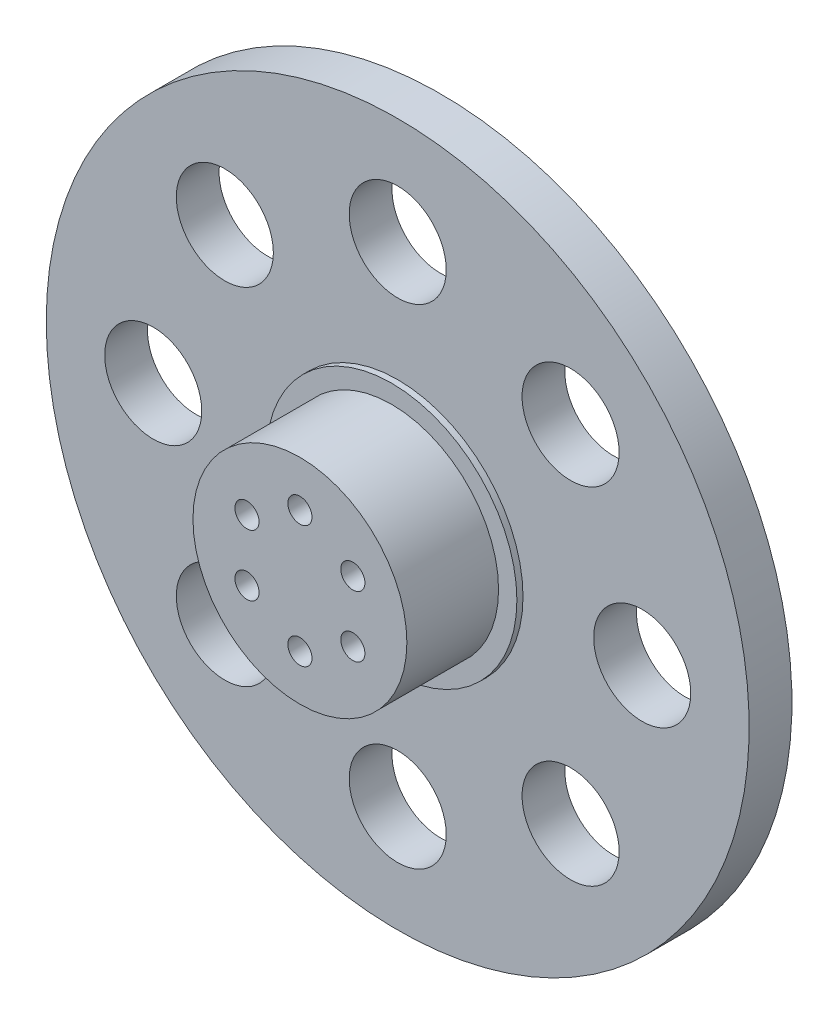
from build123d import *

# Parameters (mm, degrees)
SKETCH1_R           = 17.5
BOSS_EXTRUDE1_DEPTH = 15
SKETCH7_R           = 20.5
BOSS_EXTRUDE3_DEPTH = 1
SKETCH3_R           = 57.5
BOSS_EXTRUDE2_DEPTH = 7
SKETCH4_R           = 11
CUT_EXTRUDE1_DEPTH  = 7
SKETCH5_R           = 7.5
CUT_EXTRUDE2_DEPTH  = 0.5
SKETCH6_R           = 1.975
CUT_EXTRUDE3_DEPTH  = 6
CIRPATTERN1_COUNT   = 6
SKETCH8_R           = 7.94
CUT_EXTRUDE4_DEPTH  = 83.876414015


with BuildPart() as part:
    # Sketch1 → Boss-Extrude1 (new body)
    with BuildSketch(Plane.XY):
        Circle(SKETCH1_R)
    extrude(amount=BOSS_EXTRUDE1_DEPTH)

    # Sketch7 → Boss-Extrude3 (add)
    with BuildSketch(Plane(origin=(0, 0, 0), x_dir=(-1, 0, 0), z_dir=(0, 0, -1))):
        Circle(SKETCH7_R)
    extrude(amount=BOSS_EXTRUDE3_DEPTH)

    # Sketch3 → Boss-Extrude2 (add)
    with BuildSketch(Plane(origin=(0, 0, -1), x_dir=(-1, 0, 0), z_dir=(0, 0, -1))):
        Circle(SKETCH3_R)
    extrude(amount=BOSS_EXTRUDE2_DEPTH)

    # Sketch4 → Cut-Extrude1 (cut)
    with BuildSketch(Plane(origin=(0, 0, -8), x_dir=(-1, 0, 0), z_dir=(0, 0, -1))):
        Circle(SKETCH4_R)
    extrude(amount=-CUT_EXTRUDE1_DEPTH, mode=Mode.SUBTRACT)

    # Sketch5 → Cut-Extrude2 (cut)
    with BuildSketch(Plane(origin=(0, 0, -1), x_dir=(-1, 0, 0), z_dir=(0, 0, -1))):
        Circle(SKETCH5_R)
    extrude(amount=-CUT_EXTRUDE2_DEPTH, mode=Mode.SUBTRACT)

    # Sketch6 → Cut-Extrude3 (cut)
    with BuildSketch(Plane.XY.offset(15)):
        with Locations((0, 10)):
            Circle(SKETCH6_R)
    cut_extrude3 = extrude(amount=-CUT_EXTRUDE3_DEPTH, mode=Mode.SUBTRACT)

    # CirPattern1: Cut-Extrude3 ×6 about axis
    cirpattern1_axis = Axis((0, 0, 15), (0, 0, 1))
    for i in range(1, CIRPATTERN1_COUNT):
        add(cut_extrude3.rotate(cirpattern1_axis, i * 360 / CIRPATTERN1_COUNT), mode=Mode.SUBTRACT)

    # Sketch8 → Cut-Extrude4 (cut, through all)
    with BuildSketch(Plane.XY.offset(-1)):
        with Locations((-40, 0)):
            Circle(SKETCH8_R)
        with Locations((-28.284271247, 28.284271247)):
            Circle(SKETCH8_R)
        with Locations((0, 40)):
            Circle(SKETCH8_R)
        with Locations((28.284271247, 28.284271247)):
            Circle(SKETCH8_R)
        with Locations((40, 0)):
            Circle(SKETCH8_R)
        with Locations((28.284271247, -28.284271247)):
            Circle(SKETCH8_R)
        with Locations((0, -40)):
            Circle(SKETCH8_R)
        with Locations((-28.284271247, -28.284271247)):
            Circle(SKETCH8_R)
    extrude(amount=-CUT_EXTRUDE4_DEPTH, mode=Mode.SUBTRACT)


solid = part.part
